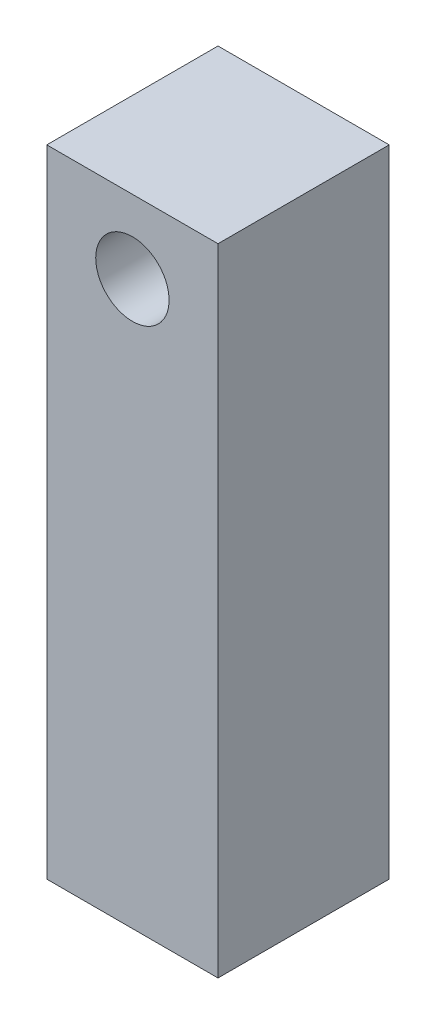
from build123d import *

# Parameters (mm, degrees)
SKETCH1_W                       = 7
SKETCH1_H                       = 7
SKETCH1_R                       = 2
BOSS_EXTRUDE1_DEPTH             = 20
BOSS_EXTRUDE2_REACH             = 22.603
SKETCH2_W                       = 7
SKETCH2_H                       = 6
SKETCH2_R                       = 1.5
BOSS_EXTRUDE2_DIRECTION_2_REACH = 22.603


with BuildPart() as part:
    # Sketch1 → Boss-Extrude1 (new body)
    with BuildSketch(Plane(origin=(0, 0, 0), x_dir=(1, 0, 0), z_dir=(0, 1, 0))):
        Rectangle(SKETCH1_W, SKETCH1_H)
        Circle(SKETCH1_R, mode=Mode.SUBTRACT)
    extrude(amount=BOSS_EXTRUDE1_DEPTH)

    # Boss-Extrude2: up to this face of the body (flat: up to its plane)
    boss_extrude2_end = Plane(part.part.faces().sort_by_distance((0, 10, 3.5))[0])
    # Sketch2 → Boss-Extrude2 (add, up to the picked face)
    with BuildSketch(Plane.XY, mode=Mode.PRIVATE) as boss_extrude2_sk1:
        with Locations((0, 23)):
            Rectangle(SKETCH2_W, SKETCH2_H)
        with Locations((0, 23)):
            Circle(SKETCH2_R, mode=Mode.SUBTRACT)
    boss_extrude2_tool1 = split(extrude(boss_extrude2_sk1.sketch, amount=BOSS_EXTRUDE2_REACH, mode=Mode.PRIVATE), bisect_by=boss_extrude2_end, keep=Keep.BOTH, mode=Mode.PRIVATE)
    add(boss_extrude2_tool1.solids().sort_by(Axis((0, 25.907805, 0), (0, 0, 1)))[0])

    # Boss-Extrude2 direction 2: up to this face of the body (flat: up to its plane)
    boss_extrude2_direction_2_end = Plane(part.part.faces().sort_by_distance((0, 10, -3.5))[0])
    # Sketch2 → Boss-Extrude2 direction 2 (add, up to the picked face)
    with BuildSketch(Plane.XY, mode=Mode.PRIVATE) as boss_extrude2_direction_2_sk1:
        with Locations((0, 23)):
            Rectangle(SKETCH2_W, SKETCH2_H)
        with Locations((0, 23)):
            Circle(SKETCH2_R, mode=Mode.SUBTRACT)
    boss_extrude2_direction_2_tool1 = split(extrude(boss_extrude2_direction_2_sk1.sketch, amount=-BOSS_EXTRUDE2_DIRECTION_2_REACH, mode=Mode.PRIVATE), bisect_by=boss_extrude2_direction_2_end, keep=Keep.BOTH, mode=Mode.PRIVATE)
    add(boss_extrude2_direction_2_tool1.solids().sort_by(Axis((0, 25.907805, 0), (0, 0, -1)))[0])


solid = part.part
